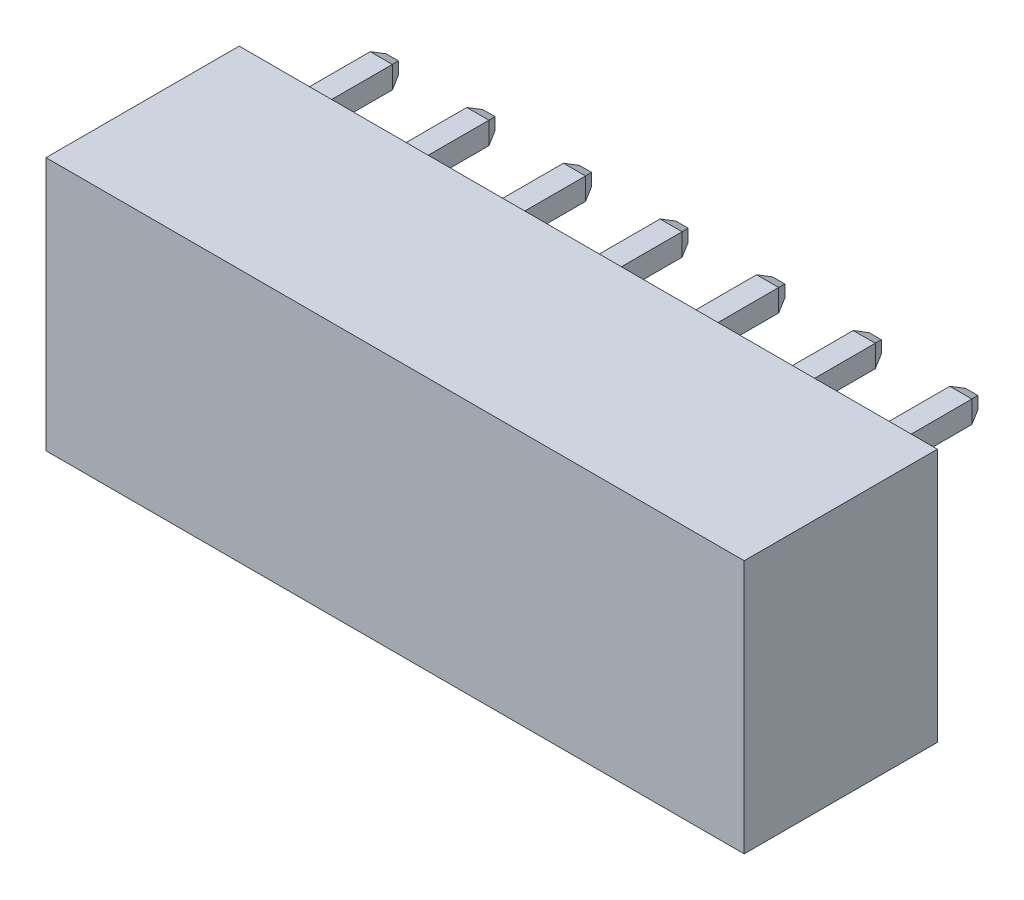
from build123d import *
from OCP.BRepFilletAPI import BRepFilletAPI_MakeChamfer

# Parameters (mm, degrees)
SKETCH_1_W                          = 25.3
SKETCH_1_H                          = 9.2
EXTRUDE_1_DEPTH                     = 7
SKETCH_2_W                          = 0.8
SKETCH_2_H                          = 0.8
EXTRUDE_2_DEPTH                     = 3.4
CHAMFER_1_SIZE                      = 0.4
CHAMFER_1_SIZE2                     = 0.178091474
CUT_EXTRUDE_1_DEPTH                 = 7
PATTERN_LINEAR_1_COUNT              = 7
PATTERN_LINEAR_1_PITCH              = 3.5
CHAMFER_1_OF_PATTERN_LINEAR_1_SIZE  = 0.4
CHAMFER_1_OF_PATTERN_LINEAR_1_SIZE2 = 0.178091474
PATTERN_LINEAR_2_COUNT              = 7
PATTERN_LINEAR_2_PITCH              = 3.5
SKETCH_4_W                          = 0.8
SKETCH_4_H                          = 0.8
EXTRUDE_3_DEPTH                     = 6
CHAMFER_2_SIZE                      = 0.4
CHAMFER_2_SIZE2                     = 0.178091474
PATTERN_LINEAR_3_COUNT              = 7
PATTERN_LINEAR_3_PITCH              = 3.5
CHAMFER_2_OF_PATTERN_LINEAR_3_SIZE  = 0.4
CHAMFER_2_OF_PATTERN_LINEAR_3_SIZE2 = 0.178091474


with BuildPart() as part:
    # Эскиз1 → Бобышка-Вытянуть1 (new body)
    with BuildSketch(Plane.XY):
        with Locations((0, 4.6)):
            Rectangle(SKETCH_1_W, SKETCH_1_H)
    extrude(amount=EXTRUDE_1_DEPTH)

    # Эскиз2 → Бобышка-Вытянуть2 (add)
    with BuildSketch(Plane(origin=(0, 0, 0), x_dir=(-1, 0, 0), z_dir=(0, 0, -1))):
        with Locations((-10.5, 8)):
            Rectangle(SKETCH_2_W, SKETCH_2_H)
    extrude_2 = extrude(amount=EXTRUDE_2_DEPTH)

    # Фаска1: one chamfer whose edges measure the first distance from different faces: ONE call of the kernel's chamfer builder (chamfer() names one face for all edges)
    chamfer_1_edges_1 = [part.edges().sort_by_distance(p)[0] for p in [
        (10.5, 8.4, -3.4),
    ]]
    chamfer_1_side_1 = [part.faces().sort_by_distance(p)[0] for p in [
        (10.5, 8.4, -1.7),
    ]]
    chamfer_1_edges_2 = [part.edges().sort_by_distance(p)[0] for p in [
        (10.1, 8, -3.4),
    ]]
    chamfer_1_side_2 = [part.faces().sort_by_distance(p)[0] for p in [
        (10.1, 8, -1.7),
    ]]
    chamfer_1_edges_3 = [part.edges().sort_by_distance(p)[0] for p in [
        (10.5, 7.6, -3.4),
    ]]
    chamfer_1_side_3 = [part.faces().sort_by_distance(p)[0] for p in [
        (10.5, 7.6, -1.7),
    ]]
    chamfer_1_edges_4 = [part.edges().sort_by_distance(p)[0] for p in [
        (10.9, 8, -3.4),
    ]]
    chamfer_1_side_4 = [part.faces().sort_by_distance(p)[0] for p in [
        (10.9, 8, -1.7),
    ]]
    chamfer_1 = BRepFilletAPI_MakeChamfer(part.part.solid().wrapped)
    for e in chamfer_1_edges_1:
        chamfer_1.Add(CHAMFER_1_SIZE, CHAMFER_1_SIZE2, e.wrapped, chamfer_1_side_1[0].wrapped)  # the first distance lies on this face
    for e in chamfer_1_edges_2:
        chamfer_1.Add(CHAMFER_1_SIZE, CHAMFER_1_SIZE2, e.wrapped, chamfer_1_side_2[0].wrapped)  # the first distance lies on this face
    for e in chamfer_1_edges_3:
        chamfer_1.Add(CHAMFER_1_SIZE, CHAMFER_1_SIZE2, e.wrapped, chamfer_1_side_3[0].wrapped)  # the first distance lies on this face
    for e in chamfer_1_edges_4:
        chamfer_1.Add(CHAMFER_1_SIZE, CHAMFER_1_SIZE2, e.wrapped, chamfer_1_side_4[0].wrapped)  # the first distance lies on this face
    add(Compound.cast(chamfer_1.Shape()), mode=Mode.REPLACE)

    # Эскиз3 → Вырез-Вытянуть1 (cut)
    with BuildSketch(Plane.XZ):
        Polygon((8.9, 0.8), (12, 0.8), (12, 5), (11, 5), (12, 6.5), (8.9, 6.5), (9.9, 5), (8.9, 5), align=None)
    cut_extrude_1 = extrude(amount=-CUT_EXTRUDE_1_DEPTH, mode=Mode.SUBTRACT)

    # Линейный массив1: Бобышка-Вытянуть2 ×7
    with Locations(*[(-i * PATTERN_LINEAR_1_PITCH, 0, 0) for i in range(1, PATTERN_LINEAR_1_COUNT)]):
        add(extrude_2)

    # Фаска1 of Линейный массив1: one chamfer whose edges measure the first distance from different faces: ONE call of the kernel's chamfer builder (chamfer() names one face for all edges)
    chamfer_1_of_pattern_linear_1_edges_1 = [part.edges().sort_by_distance(p)[0] for p in [
        (7, 8.4, -3.4),
    ]]
    chamfer_1_of_pattern_linear_1_side_1 = [part.faces().sort_by_distance(p)[0] for p in [
        (7, 8.4, -1.7),
    ]]
    chamfer_1_of_pattern_linear_1_edges_2 = [part.edges().sort_by_distance(p)[0] for p in [
        (6.6, 8, -3.4),
    ]]
    chamfer_1_of_pattern_linear_1_side_2 = [part.faces().sort_by_distance(p)[0] for p in [
        (6.6, 8, -1.7),
    ]]
    chamfer_1_of_pattern_linear_1_edges_3 = [part.edges().sort_by_distance(p)[0] for p in [
        (7, 7.6, -3.4),
    ]]
    chamfer_1_of_pattern_linear_1_side_3 = [part.faces().sort_by_distance(p)[0] for p in [
        (7, 7.6, -1.7),
    ]]
    chamfer_1_of_pattern_linear_1_edges_4 = [part.edges().sort_by_distance(p)[0] for p in [
        (7.4, 8, -3.4),
    ]]
    chamfer_1_of_pattern_linear_1_side_4 = [part.faces().sort_by_distance(p)[0] for p in [
        (7.4, 8, -1.7),
    ]]
    chamfer_1_of_pattern_linear_1_edges_5 = [part.edges().sort_by_distance(p)[0] for p in [
        (3.5, 8.4, -3.4),
    ]]
    chamfer_1_of_pattern_linear_1_side_5 = [part.faces().sort_by_distance(p)[0] for p in [
        (3.5, 8.4, -1.7),
    ]]
    chamfer_1_of_pattern_linear_1_edges_6 = [part.edges().sort_by_distance(p)[0] for p in [
        (3.1, 8, -3.4),
    ]]
    chamfer_1_of_pattern_linear_1_side_6 = [part.faces().sort_by_distance(p)[0] for p in [
        (3.1, 8, -1.7),
    ]]
    chamfer_1_of_pattern_linear_1_edges_7 = [part.edges().sort_by_distance(p)[0] for p in [
        (3.5, 7.6, -3.4),
    ]]
    chamfer_1_of_pattern_linear_1_side_7 = [part.faces().sort_by_distance(p)[0] for p in [
        (3.5, 7.6, -1.7),
    ]]
    chamfer_1_of_pattern_linear_1_edges_8 = [part.edges().sort_by_distance(p)[0] for p in [
        (3.9, 8, -3.4),
    ]]
    chamfer_1_of_pattern_linear_1_side_8 = [part.faces().sort_by_distance(p)[0] for p in [
        (3.9, 8, -1.7),
    ]]
    chamfer_1_of_pattern_linear_1_edges_9 = [part.edges().sort_by_distance(p)[0] for p in [
        (0, 8.4, -3.4),
    ]]
    chamfer_1_of_pattern_linear_1_side_9 = [part.faces().sort_by_distance(p)[0] for p in [
        (0, 8.4, -1.7),
    ]]
    chamfer_1_of_pattern_linear_1_edges_10 = [part.edges().sort_by_distance(p)[0] for p in [
        (-0.4, 8, -3.4),
    ]]
    chamfer_1_of_pattern_linear_1_side_10 = [part.faces().sort_by_distance(p)[0] for p in [
        (-0.4, 8, -1.7),
    ]]
    chamfer_1_of_pattern_linear_1_edges_11 = [part.edges().sort_by_distance(p)[0] for p in [
        (0, 7.6, -3.4),
    ]]
    chamfer_1_of_pattern_linear_1_side_11 = [part.faces().sort_by_distance(p)[0] for p in [
        (0, 7.6, -1.7),
    ]]
    chamfer_1_of_pattern_linear_1_edges_12 = [part.edges().sort_by_distance(p)[0] for p in [
        (0.4, 8, -3.4),
    ]]
    chamfer_1_of_pattern_linear_1_side_12 = [part.faces().sort_by_distance(p)[0] for p in [
        (0.4, 8, -1.7),
    ]]
    chamfer_1_of_pattern_linear_1_edges_13 = [part.edges().sort_by_distance(p)[0] for p in [
        (-3.5, 8.4, -3.4),
    ]]
    chamfer_1_of_pattern_linear_1_side_13 = [part.faces().sort_by_distance(p)[0] for p in [
        (-3.5, 8.4, -1.7),
    ]]
    chamfer_1_of_pattern_linear_1_edges_14 = [part.edges().sort_by_distance(p)[0] for p in [
        (-3.9, 8, -3.4),
    ]]
    chamfer_1_of_pattern_linear_1_side_14 = [part.faces().sort_by_distance(p)[0] for p in [
        (-3.9, 8, -1.7),
    ]]
    chamfer_1_of_pattern_linear_1_edges_15 = [part.edges().sort_by_distance(p)[0] for p in [
        (-3.5, 7.6, -3.4),
    ]]
    chamfer_1_of_pattern_linear_1_side_15 = [part.faces().sort_by_distance(p)[0] for p in [
        (-3.5, 7.6, -1.7),
    ]]
    chamfer_1_of_pattern_linear_1_edges_16 = [part.edges().sort_by_distance(p)[0] for p in [
        (-3.1, 8, -3.4),
    ]]
    chamfer_1_of_pattern_linear_1_side_16 = [part.faces().sort_by_distance(p)[0] for p in [
        (-3.1, 8, -1.7),
    ]]
    chamfer_1_of_pattern_linear_1_edges_17 = [part.edges().sort_by_distance(p)[0] for p in [
        (-7, 8.4, -3.4),
    ]]
    chamfer_1_of_pattern_linear_1_side_17 = [part.faces().sort_by_distance(p)[0] for p in [
        (-7, 8.4, -1.7),
    ]]
    chamfer_1_of_pattern_linear_1_edges_18 = [part.edges().sort_by_distance(p)[0] for p in [
        (-7.4, 8, -3.4),
    ]]
    chamfer_1_of_pattern_linear_1_side_18 = [part.faces().sort_by_distance(p)[0] for p in [
        (-7.4, 8, -1.7),
    ]]
    chamfer_1_of_pattern_linear_1_edges_19 = [part.edges().sort_by_distance(p)[0] for p in [
        (-7, 7.6, -3.4),
    ]]
    chamfer_1_of_pattern_linear_1_side_19 = [part.faces().sort_by_distance(p)[0] for p in [
        (-7, 7.6, -1.7),
    ]]
    chamfer_1_of_pattern_linear_1_edges_20 = [part.edges().sort_by_distance(p)[0] for p in [
        (-6.6, 8, -3.4),
    ]]
    chamfer_1_of_pattern_linear_1_side_20 = [part.faces().sort_by_distance(p)[0] for p in [
        (-6.6, 8, -1.7),
    ]]
    chamfer_1_of_pattern_linear_1_edges_21 = [part.edges().sort_by_distance(p)[0] for p in [
        (-10.5, 8.4, -3.4),
    ]]
    chamfer_1_of_pattern_linear_1_side_21 = [part.faces().sort_by_distance(p)[0] for p in [
        (-10.5, 8.4, -1.7),
    ]]
    chamfer_1_of_pattern_linear_1_edges_22 = [part.edges().sort_by_distance(p)[0] for p in [
        (-10.9, 8, -3.4),
    ]]
    chamfer_1_of_pattern_linear_1_side_22 = [part.faces().sort_by_distance(p)[0] for p in [
        (-10.9, 8, -1.7),
    ]]
    chamfer_1_of_pattern_linear_1_edges_23 = [part.edges().sort_by_distance(p)[0] for p in [
        (-10.5, 7.6, -3.4),
    ]]
    chamfer_1_of_pattern_linear_1_side_23 = [part.faces().sort_by_distance(p)[0] for p in [
        (-10.5, 7.6, -1.7),
    ]]
    chamfer_1_of_pattern_linear_1_edges_24 = [part.edges().sort_by_distance(p)[0] for p in [
        (-10.1, 8, -3.4),
    ]]
    chamfer_1_of_pattern_linear_1_side_24 = [part.faces().sort_by_distance(p)[0] for p in [
        (-10.1, 8, -1.7),
    ]]
    chamfer_1_of_pattern_linear_1 = BRepFilletAPI_MakeChamfer(part.part.solid().wrapped)
    for e in chamfer_1_of_pattern_linear_1_edges_1:
        chamfer_1_of_pattern_linear_1.Add(CHAMFER_1_OF_PATTERN_LINEAR_1_SIZE, CHAMFER_1_OF_PATTERN_LINEAR_1_SIZE2, e.wrapped, chamfer_1_of_pattern_linear_1_side_1[0].wrapped)  # the first distance lies on this face
    for e in chamfer_1_of_pattern_linear_1_edges_2:
        chamfer_1_of_pattern_linear_1.Add(CHAMFER_1_OF_PATTERN_LINEAR_1_SIZE, CHAMFER_1_OF_PATTERN_LINEAR_1_SIZE2, e.wrapped, chamfer_1_of_pattern_linear_1_side_2[0].wrapped)  # the first distance lies on this face
    for e in chamfer_1_of_pattern_linear_1_edges_3:
        chamfer_1_of_pattern_linear_1.Add(CHAMFER_1_OF_PATTERN_LINEAR_1_SIZE, CHAMFER_1_OF_PATTERN_LINEAR_1_SIZE2, e.wrapped, chamfer_1_of_pattern_linear_1_side_3[0].wrapped)  # the first distance lies on this face
    for e in chamfer_1_of_pattern_linear_1_edges_4:
        chamfer_1_of_pattern_linear_1.Add(CHAMFER_1_OF_PATTERN_LINEAR_1_SIZE, CHAMFER_1_OF_PATTERN_LINEAR_1_SIZE2, e.wrapped, chamfer_1_of_pattern_linear_1_side_4[0].wrapped)  # the first distance lies on this face
    for e in chamfer_1_of_pattern_linear_1_edges_5:
        chamfer_1_of_pattern_linear_1.Add(CHAMFER_1_OF_PATTERN_LINEAR_1_SIZE, CHAMFER_1_OF_PATTERN_LINEAR_1_SIZE2, e.wrapped, chamfer_1_of_pattern_linear_1_side_5[0].wrapped)  # the first distance lies on this face
    for e in chamfer_1_of_pattern_linear_1_edges_6:
        chamfer_1_of_pattern_linear_1.Add(CHAMFER_1_OF_PATTERN_LINEAR_1_SIZE, CHAMFER_1_OF_PATTERN_LINEAR_1_SIZE2, e.wrapped, chamfer_1_of_pattern_linear_1_side_6[0].wrapped)  # the first distance lies on this face
    for e in chamfer_1_of_pattern_linear_1_edges_7:
        chamfer_1_of_pattern_linear_1.Add(CHAMFER_1_OF_PATTERN_LINEAR_1_SIZE, CHAMFER_1_OF_PATTERN_LINEAR_1_SIZE2, e.wrapped, chamfer_1_of_pattern_linear_1_side_7[0].wrapped)  # the first distance lies on this face
    for e in chamfer_1_of_pattern_linear_1_edges_8:
        chamfer_1_of_pattern_linear_1.Add(CHAMFER_1_OF_PATTERN_LINEAR_1_SIZE, CHAMFER_1_OF_PATTERN_LINEAR_1_SIZE2, e.wrapped, chamfer_1_of_pattern_linear_1_side_8[0].wrapped)  # the first distance lies on this face
    for e in chamfer_1_of_pattern_linear_1_edges_9:
        chamfer_1_of_pattern_linear_1.Add(CHAMFER_1_OF_PATTERN_LINEAR_1_SIZE, CHAMFER_1_OF_PATTERN_LINEAR_1_SIZE2, e.wrapped, chamfer_1_of_pattern_linear_1_side_9[0].wrapped)  # the first distance lies on this face
    for e in chamfer_1_of_pattern_linear_1_edges_10:
        chamfer_1_of_pattern_linear_1.Add(CHAMFER_1_OF_PATTERN_LINEAR_1_SIZE, CHAMFER_1_OF_PATTERN_LINEAR_1_SIZE2, e.wrapped, chamfer_1_of_pattern_linear_1_side_10[0].wrapped)  # the first distance lies on this face
    for e in chamfer_1_of_pattern_linear_1_edges_11:
        chamfer_1_of_pattern_linear_1.Add(CHAMFER_1_OF_PATTERN_LINEAR_1_SIZE, CHAMFER_1_OF_PATTERN_LINEAR_1_SIZE2, e.wrapped, chamfer_1_of_pattern_linear_1_side_11[0].wrapped)  # the first distance lies on this face
    for e in chamfer_1_of_pattern_linear_1_edges_12:
        chamfer_1_of_pattern_linear_1.Add(CHAMFER_1_OF_PATTERN_LINEAR_1_SIZE, CHAMFER_1_OF_PATTERN_LINEAR_1_SIZE2, e.wrapped, chamfer_1_of_pattern_linear_1_side_12[0].wrapped)  # the first distance lies on this face
    for e in chamfer_1_of_pattern_linear_1_edges_13:
        chamfer_1_of_pattern_linear_1.Add(CHAMFER_1_OF_PATTERN_LINEAR_1_SIZE, CHAMFER_1_OF_PATTERN_LINEAR_1_SIZE2, e.wrapped, chamfer_1_of_pattern_linear_1_side_13[0].wrapped)  # the first distance lies on this face
    for e in chamfer_1_of_pattern_linear_1_edges_14:
        chamfer_1_of_pattern_linear_1.Add(CHAMFER_1_OF_PATTERN_LINEAR_1_SIZE, CHAMFER_1_OF_PATTERN_LINEAR_1_SIZE2, e.wrapped, chamfer_1_of_pattern_linear_1_side_14[0].wrapped)  # the first distance lies on this face
    for e in chamfer_1_of_pattern_linear_1_edges_15:
        chamfer_1_of_pattern_linear_1.Add(CHAMFER_1_OF_PATTERN_LINEAR_1_SIZE, CHAMFER_1_OF_PATTERN_LINEAR_1_SIZE2, e.wrapped, chamfer_1_of_pattern_linear_1_side_15[0].wrapped)  # the first distance lies on this face
    for e in chamfer_1_of_pattern_linear_1_edges_16:
        chamfer_1_of_pattern_linear_1.Add(CHAMFER_1_OF_PATTERN_LINEAR_1_SIZE, CHAMFER_1_OF_PATTERN_LINEAR_1_SIZE2, e.wrapped, chamfer_1_of_pattern_linear_1_side_16[0].wrapped)  # the first distance lies on this face
    for e in chamfer_1_of_pattern_linear_1_edges_17:
        chamfer_1_of_pattern_linear_1.Add(CHAMFER_1_OF_PATTERN_LINEAR_1_SIZE, CHAMFER_1_OF_PATTERN_LINEAR_1_SIZE2, e.wrapped, chamfer_1_of_pattern_linear_1_side_17[0].wrapped)  # the first distance lies on this face
    for e in chamfer_1_of_pattern_linear_1_edges_18:
        chamfer_1_of_pattern_linear_1.Add(CHAMFER_1_OF_PATTERN_LINEAR_1_SIZE, CHAMFER_1_OF_PATTERN_LINEAR_1_SIZE2, e.wrapped, chamfer_1_of_pattern_linear_1_side_18[0].wrapped)  # the first distance lies on this face
    for e in chamfer_1_of_pattern_linear_1_edges_19:
        chamfer_1_of_pattern_linear_1.Add(CHAMFER_1_OF_PATTERN_LINEAR_1_SIZE, CHAMFER_1_OF_PATTERN_LINEAR_1_SIZE2, e.wrapped, chamfer_1_of_pattern_linear_1_side_19[0].wrapped)  # the first distance lies on this face
    for e in chamfer_1_of_pattern_linear_1_edges_20:
        chamfer_1_of_pattern_linear_1.Add(CHAMFER_1_OF_PATTERN_LINEAR_1_SIZE, CHAMFER_1_OF_PATTERN_LINEAR_1_SIZE2, e.wrapped, chamfer_1_of_pattern_linear_1_side_20[0].wrapped)  # the first distance lies on this face
    for e in chamfer_1_of_pattern_linear_1_edges_21:
        chamfer_1_of_pattern_linear_1.Add(CHAMFER_1_OF_PATTERN_LINEAR_1_SIZE, CHAMFER_1_OF_PATTERN_LINEAR_1_SIZE2, e.wrapped, chamfer_1_of_pattern_linear_1_side_21[0].wrapped)  # the first distance lies on this face
    for e in chamfer_1_of_pattern_linear_1_edges_22:
        chamfer_1_of_pattern_linear_1.Add(CHAMFER_1_OF_PATTERN_LINEAR_1_SIZE, CHAMFER_1_OF_PATTERN_LINEAR_1_SIZE2, e.wrapped, chamfer_1_of_pattern_linear_1_side_22[0].wrapped)  # the first distance lies on this face
    for e in chamfer_1_of_pattern_linear_1_edges_23:
        chamfer_1_of_pattern_linear_1.Add(CHAMFER_1_OF_PATTERN_LINEAR_1_SIZE, CHAMFER_1_OF_PATTERN_LINEAR_1_SIZE2, e.wrapped, chamfer_1_of_pattern_linear_1_side_23[0].wrapped)  # the first distance lies on this face
    for e in chamfer_1_of_pattern_linear_1_edges_24:
        chamfer_1_of_pattern_linear_1.Add(CHAMFER_1_OF_PATTERN_LINEAR_1_SIZE, CHAMFER_1_OF_PATTERN_LINEAR_1_SIZE2, e.wrapped, chamfer_1_of_pattern_linear_1_side_24[0].wrapped)  # the first distance lies on this face
    add(Compound.cast(chamfer_1_of_pattern_linear_1.Shape()), mode=Mode.REPLACE)

    # Линейный массив2: Вырез-Вытянуть1 ×7
    with Locations(*[(-i * PATTERN_LINEAR_2_PITCH, 0, 0) for i in range(1, PATTERN_LINEAR_2_COUNT)]):
        add(cut_extrude_1, mode=Mode.SUBTRACT)

    # Эскиз4 → Бобышка-Вытянуть3 (add)
    with BuildSketch(Plane.XZ.offset(-7)):
        with Locations((10.5, 3)):
            Rectangle(SKETCH_4_W, SKETCH_4_H)
    extrude_3 = extrude(amount=EXTRUDE_3_DEPTH)

    # Фаска2: one chamfer whose edges measure the first distance from different faces: ONE call of the kernel's chamfer builder (chamfer() names one face for all edges)
    chamfer_2_edges_1 = [part.edges().sort_by_distance(p)[0] for p in [
        (10.9, 1, 3),
    ]]
    chamfer_2_side_1 = [part.faces().sort_by_distance(p)[0] for p in [
        (10.9, 4, 3),
    ]]
    chamfer_2_edges_2 = [part.edges().sort_by_distance(p)[0] for p in [
        (10.5, 1, 3.4),
    ]]
    chamfer_2_side_2 = [part.faces().sort_by_distance(p)[0] for p in [
        (10.5, 4, 3.4),
    ]]
    chamfer_2_edges_3 = [part.edges().sort_by_distance(p)[0] for p in [
        (10.1, 1, 3),
    ]]
    chamfer_2_side_3 = [part.faces().sort_by_distance(p)[0] for p in [
        (10.1, 4, 3),
    ]]
    chamfer_2_edges_4 = [part.edges().sort_by_distance(p)[0] for p in [
        (10.5, 1, 2.6),
    ]]
    chamfer_2_side_4 = [part.faces().sort_by_distance(p)[0] for p in [
        (10.5, 4, 2.6),
    ]]
    chamfer_2 = BRepFilletAPI_MakeChamfer(part.part.solid().wrapped)
    for e in chamfer_2_edges_1:
        chamfer_2.Add(CHAMFER_2_SIZE, CHAMFER_2_SIZE2, e.wrapped, chamfer_2_side_1[0].wrapped)  # the first distance lies on this face
    for e in chamfer_2_edges_2:
        chamfer_2.Add(CHAMFER_2_SIZE, CHAMFER_2_SIZE2, e.wrapped, chamfer_2_side_2[0].wrapped)  # the first distance lies on this face
    for e in chamfer_2_edges_3:
        chamfer_2.Add(CHAMFER_2_SIZE, CHAMFER_2_SIZE2, e.wrapped, chamfer_2_side_3[0].wrapped)  # the first distance lies on this face
    for e in chamfer_2_edges_4:
        chamfer_2.Add(CHAMFER_2_SIZE, CHAMFER_2_SIZE2, e.wrapped, chamfer_2_side_4[0].wrapped)  # the first distance lies on this face
    add(Compound.cast(chamfer_2.Shape()), mode=Mode.REPLACE)

    # Линейный массив3: Бобышка-Вытянуть3 ×7
    with Locations(*[(-i * PATTERN_LINEAR_3_PITCH, 0, 0) for i in range(1, PATTERN_LINEAR_3_COUNT)]):
        add(extrude_3)

    # Фаска2 of Линейный массив3: one chamfer whose edges measure the first distance from different faces: ONE call of the kernel's chamfer builder (chamfer() names one face for all edges)
    chamfer_2_of_pattern_linear_3_edges_1 = [part.edges().sort_by_distance(p)[0] for p in [
        (7.4, 1, 3),
    ]]
    chamfer_2_of_pattern_linear_3_side_1 = [part.faces().sort_by_distance(p)[0] for p in [
        (7.4, 4, 3),
    ]]
    chamfer_2_of_pattern_linear_3_edges_2 = [part.edges().sort_by_distance(p)[0] for p in [
        (7, 1, 3.4),
    ]]
    chamfer_2_of_pattern_linear_3_side_2 = [part.faces().sort_by_distance(p)[0] for p in [
        (7, 4, 3.4),
    ]]
    chamfer_2_of_pattern_linear_3_edges_3 = [part.edges().sort_by_distance(p)[0] for p in [
        (6.6, 1, 3),
    ]]
    chamfer_2_of_pattern_linear_3_side_3 = [part.faces().sort_by_distance(p)[0] for p in [
        (6.6, 4, 3),
    ]]
    chamfer_2_of_pattern_linear_3_edges_4 = [part.edges().sort_by_distance(p)[0] for p in [
        (7, 1, 2.6),
    ]]
    chamfer_2_of_pattern_linear_3_side_4 = [part.faces().sort_by_distance(p)[0] for p in [
        (7, 4, 2.6),
    ]]
    chamfer_2_of_pattern_linear_3_edges_5 = [part.edges().sort_by_distance(p)[0] for p in [
        (3.9, 1, 3),
    ]]
    chamfer_2_of_pattern_linear_3_side_5 = [part.faces().sort_by_distance(p)[0] for p in [
        (3.9, 4, 3),
    ]]
    chamfer_2_of_pattern_linear_3_edges_6 = [part.edges().sort_by_distance(p)[0] for p in [
        (3.5, 1, 3.4),
    ]]
    chamfer_2_of_pattern_linear_3_side_6 = [part.faces().sort_by_distance(p)[0] for p in [
        (3.5, 4, 3.4),
    ]]
    chamfer_2_of_pattern_linear_3_edges_7 = [part.edges().sort_by_distance(p)[0] for p in [
        (3.1, 1, 3),
    ]]
    chamfer_2_of_pattern_linear_3_side_7 = [part.faces().sort_by_distance(p)[0] for p in [
        (3.1, 4, 3),
    ]]
    chamfer_2_of_pattern_linear_3_edges_8 = [part.edges().sort_by_distance(p)[0] for p in [
        (3.5, 1, 2.6),
    ]]
    chamfer_2_of_pattern_linear_3_side_8 = [part.faces().sort_by_distance(p)[0] for p in [
        (3.5, 4, 2.6),
    ]]
    chamfer_2_of_pattern_linear_3_edges_9 = [part.edges().sort_by_distance(p)[0] for p in [
        (0.4, 1, 3),
    ]]
    chamfer_2_of_pattern_linear_3_side_9 = [part.faces().sort_by_distance(p)[0] for p in [
        (0.4, 4, 3),
    ]]
    chamfer_2_of_pattern_linear_3_edges_10 = [part.edges().sort_by_distance(p)[0] for p in [
        (0, 1, 3.4),
    ]]
    chamfer_2_of_pattern_linear_3_side_10 = [part.faces().sort_by_distance(p)[0] for p in [
        (0, 4, 3.4),
    ]]
    chamfer_2_of_pattern_linear_3_edges_11 = [part.edges().sort_by_distance(p)[0] for p in [
        (-0.4, 1, 3),
    ]]
    chamfer_2_of_pattern_linear_3_side_11 = [part.faces().sort_by_distance(p)[0] for p in [
        (-0.4, 4, 3),
    ]]
    chamfer_2_of_pattern_linear_3_edges_12 = [part.edges().sort_by_distance(p)[0] for p in [
        (0, 1, 2.6),
    ]]
    chamfer_2_of_pattern_linear_3_side_12 = [part.faces().sort_by_distance(p)[0] for p in [
        (0, 4, 2.6),
    ]]
    chamfer_2_of_pattern_linear_3_edges_13 = [part.edges().sort_by_distance(p)[0] for p in [
        (-3.1, 1, 3),
    ]]
    chamfer_2_of_pattern_linear_3_side_13 = [part.faces().sort_by_distance(p)[0] for p in [
        (-3.1, 4, 3),
    ]]
    chamfer_2_of_pattern_linear_3_edges_14 = [part.edges().sort_by_distance(p)[0] for p in [
        (-3.5, 1, 3.4),
    ]]
    chamfer_2_of_pattern_linear_3_side_14 = [part.faces().sort_by_distance(p)[0] for p in [
        (-3.5, 4, 3.4),
    ]]
    chamfer_2_of_pattern_linear_3_edges_15 = [part.edges().sort_by_distance(p)[0] for p in [
        (-3.9, 1, 3),
    ]]
    chamfer_2_of_pattern_linear_3_side_15 = [part.faces().sort_by_distance(p)[0] for p in [
        (-3.9, 4, 3),
    ]]
    chamfer_2_of_pattern_linear_3_edges_16 = [part.edges().sort_by_distance(p)[0] for p in [
        (-3.5, 1, 2.6),
    ]]
    chamfer_2_of_pattern_linear_3_side_16 = [part.faces().sort_by_distance(p)[0] for p in [
        (-3.5, 4, 2.6),
    ]]
    chamfer_2_of_pattern_linear_3_edges_17 = [part.edges().sort_by_distance(p)[0] for p in [
        (-6.6, 1, 3),
    ]]
    chamfer_2_of_pattern_linear_3_side_17 = [part.faces().sort_by_distance(p)[0] for p in [
        (-6.6, 4, 3),
    ]]
    chamfer_2_of_pattern_linear_3_edges_18 = [part.edges().sort_by_distance(p)[0] for p in [
        (-7, 1, 3.4),
    ]]
    chamfer_2_of_pattern_linear_3_side_18 = [part.faces().sort_by_distance(p)[0] for p in [
        (-7, 4, 3.4),
    ]]
    chamfer_2_of_pattern_linear_3_edges_19 = [part.edges().sort_by_distance(p)[0] for p in [
        (-7.4, 1, 3),
    ]]
    chamfer_2_of_pattern_linear_3_side_19 = [part.faces().sort_by_distance(p)[0] for p in [
        (-7.4, 4, 3),
    ]]
    chamfer_2_of_pattern_linear_3_edges_20 = [part.edges().sort_by_distance(p)[0] for p in [
        (-7, 1, 2.6),
    ]]
    chamfer_2_of_pattern_linear_3_side_20 = [part.faces().sort_by_distance(p)[0] for p in [
        (-7, 4, 2.6),
    ]]
    chamfer_2_of_pattern_linear_3_edges_21 = [part.edges().sort_by_distance(p)[0] for p in [
        (-10.1, 1, 3),
    ]]
    chamfer_2_of_pattern_linear_3_side_21 = [part.faces().sort_by_distance(p)[0] for p in [
        (-10.1, 4, 3),
    ]]
    chamfer_2_of_pattern_linear_3_edges_22 = [part.edges().sort_by_distance(p)[0] for p in [
        (-10.5, 1, 3.4),
    ]]
    chamfer_2_of_pattern_linear_3_side_22 = [part.faces().sort_by_distance(p)[0] for p in [
        (-10.5, 4, 3.4),
    ]]
    chamfer_2_of_pattern_linear_3_edges_23 = [part.edges().sort_by_distance(p)[0] for p in [
        (-10.9, 1, 3),
    ]]
    chamfer_2_of_pattern_linear_3_side_23 = [part.faces().sort_by_distance(p)[0] for p in [
        (-10.9, 4, 3),
    ]]
    chamfer_2_of_pattern_linear_3_edges_24 = [part.edges().sort_by_distance(p)[0] for p in [
        (-10.5, 1, 2.6),
    ]]
    chamfer_2_of_pattern_linear_3_side_24 = [part.faces().sort_by_distance(p)[0] for p in [
        (-10.5, 4, 2.6),
    ]]
    chamfer_2_of_pattern_linear_3 = BRepFilletAPI_MakeChamfer(part.part.solid().wrapped)
    for e in chamfer_2_of_pattern_linear_3_edges_1:
        chamfer_2_of_pattern_linear_3.Add(CHAMFER_2_OF_PATTERN_LINEAR_3_SIZE, CHAMFER_2_OF_PATTERN_LINEAR_3_SIZE2, e.wrapped, chamfer_2_of_pattern_linear_3_side_1[0].wrapped)  # the first distance lies on this face
    for e in chamfer_2_of_pattern_linear_3_edges_2:
        chamfer_2_of_pattern_linear_3.Add(CHAMFER_2_OF_PATTERN_LINEAR_3_SIZE, CHAMFER_2_OF_PATTERN_LINEAR_3_SIZE2, e.wrapped, chamfer_2_of_pattern_linear_3_side_2[0].wrapped)  # the first distance lies on this face
    for e in chamfer_2_of_pattern_linear_3_edges_3:
        chamfer_2_of_pattern_linear_3.Add(CHAMFER_2_OF_PATTERN_LINEAR_3_SIZE, CHAMFER_2_OF_PATTERN_LINEAR_3_SIZE2, e.wrapped, chamfer_2_of_pattern_linear_3_side_3[0].wrapped)  # the first distance lies on this face
    for e in chamfer_2_of_pattern_linear_3_edges_4:
        chamfer_2_of_pattern_linear_3.Add(CHAMFER_2_OF_PATTERN_LINEAR_3_SIZE, CHAMFER_2_OF_PATTERN_LINEAR_3_SIZE2, e.wrapped, chamfer_2_of_pattern_linear_3_side_4[0].wrapped)  # the first distance lies on this face
    for e in chamfer_2_of_pattern_linear_3_edges_5:
        chamfer_2_of_pattern_linear_3.Add(CHAMFER_2_OF_PATTERN_LINEAR_3_SIZE, CHAMFER_2_OF_PATTERN_LINEAR_3_SIZE2, e.wrapped, chamfer_2_of_pattern_linear_3_side_5[0].wrapped)  # the first distance lies on this face
    for e in chamfer_2_of_pattern_linear_3_edges_6:
        chamfer_2_of_pattern_linear_3.Add(CHAMFER_2_OF_PATTERN_LINEAR_3_SIZE, CHAMFER_2_OF_PATTERN_LINEAR_3_SIZE2, e.wrapped, chamfer_2_of_pattern_linear_3_side_6[0].wrapped)  # the first distance lies on this face
    for e in chamfer_2_of_pattern_linear_3_edges_7:
        chamfer_2_of_pattern_linear_3.Add(CHAMFER_2_OF_PATTERN_LINEAR_3_SIZE, CHAMFER_2_OF_PATTERN_LINEAR_3_SIZE2, e.wrapped, chamfer_2_of_pattern_linear_3_side_7[0].wrapped)  # the first distance lies on this face
    for e in chamfer_2_of_pattern_linear_3_edges_8:
        chamfer_2_of_pattern_linear_3.Add(CHAMFER_2_OF_PATTERN_LINEAR_3_SIZE, CHAMFER_2_OF_PATTERN_LINEAR_3_SIZE2, e.wrapped, chamfer_2_of_pattern_linear_3_side_8[0].wrapped)  # the first distance lies on this face
    for e in chamfer_2_of_pattern_linear_3_edges_9:
        chamfer_2_of_pattern_linear_3.Add(CHAMFER_2_OF_PATTERN_LINEAR_3_SIZE, CHAMFER_2_OF_PATTERN_LINEAR_3_SIZE2, e.wrapped, chamfer_2_of_pattern_linear_3_side_9[0].wrapped)  # the first distance lies on this face
    for e in chamfer_2_of_pattern_linear_3_edges_10:
        chamfer_2_of_pattern_linear_3.Add(CHAMFER_2_OF_PATTERN_LINEAR_3_SIZE, CHAMFER_2_OF_PATTERN_LINEAR_3_SIZE2, e.wrapped, chamfer_2_of_pattern_linear_3_side_10[0].wrapped)  # the first distance lies on this face
    for e in chamfer_2_of_pattern_linear_3_edges_11:
        chamfer_2_of_pattern_linear_3.Add(CHAMFER_2_OF_PATTERN_LINEAR_3_SIZE, CHAMFER_2_OF_PATTERN_LINEAR_3_SIZE2, e.wrapped, chamfer_2_of_pattern_linear_3_side_11[0].wrapped)  # the first distance lies on this face
    for e in chamfer_2_of_pattern_linear_3_edges_12:
        chamfer_2_of_pattern_linear_3.Add(CHAMFER_2_OF_PATTERN_LINEAR_3_SIZE, CHAMFER_2_OF_PATTERN_LINEAR_3_SIZE2, e.wrapped, chamfer_2_of_pattern_linear_3_side_12[0].wrapped)  # the first distance lies on this face
    for e in chamfer_2_of_pattern_linear_3_edges_13:
        chamfer_2_of_pattern_linear_3.Add(CHAMFER_2_OF_PATTERN_LINEAR_3_SIZE, CHAMFER_2_OF_PATTERN_LINEAR_3_SIZE2, e.wrapped, chamfer_2_of_pattern_linear_3_side_13[0].wrapped)  # the first distance lies on this face
    for e in chamfer_2_of_pattern_linear_3_edges_14:
        chamfer_2_of_pattern_linear_3.Add(CHAMFER_2_OF_PATTERN_LINEAR_3_SIZE, CHAMFER_2_OF_PATTERN_LINEAR_3_SIZE2, e.wrapped, chamfer_2_of_pattern_linear_3_side_14[0].wrapped)  # the first distance lies on this face
    for e in chamfer_2_of_pattern_linear_3_edges_15:
        chamfer_2_of_pattern_linear_3.Add(CHAMFER_2_OF_PATTERN_LINEAR_3_SIZE, CHAMFER_2_OF_PATTERN_LINEAR_3_SIZE2, e.wrapped, chamfer_2_of_pattern_linear_3_side_15[0].wrapped)  # the first distance lies on this face
    for e in chamfer_2_of_pattern_linear_3_edges_16:
        chamfer_2_of_pattern_linear_3.Add(CHAMFER_2_OF_PATTERN_LINEAR_3_SIZE, CHAMFER_2_OF_PATTERN_LINEAR_3_SIZE2, e.wrapped, chamfer_2_of_pattern_linear_3_side_16[0].wrapped)  # the first distance lies on this face
    for e in chamfer_2_of_pattern_linear_3_edges_17:
        chamfer_2_of_pattern_linear_3.Add(CHAMFER_2_OF_PATTERN_LINEAR_3_SIZE, CHAMFER_2_OF_PATTERN_LINEAR_3_SIZE2, e.wrapped, chamfer_2_of_pattern_linear_3_side_17[0].wrapped)  # the first distance lies on this face
    for e in chamfer_2_of_pattern_linear_3_edges_18:
        chamfer_2_of_pattern_linear_3.Add(CHAMFER_2_OF_PATTERN_LINEAR_3_SIZE, CHAMFER_2_OF_PATTERN_LINEAR_3_SIZE2, e.wrapped, chamfer_2_of_pattern_linear_3_side_18[0].wrapped)  # the first distance lies on this face
    for e in chamfer_2_of_pattern_linear_3_edges_19:
        chamfer_2_of_pattern_linear_3.Add(CHAMFER_2_OF_PATTERN_LINEAR_3_SIZE, CHAMFER_2_OF_PATTERN_LINEAR_3_SIZE2, e.wrapped, chamfer_2_of_pattern_linear_3_side_19[0].wrapped)  # the first distance lies on this face
    for e in chamfer_2_of_pattern_linear_3_edges_20:
        chamfer_2_of_pattern_linear_3.Add(CHAMFER_2_OF_PATTERN_LINEAR_3_SIZE, CHAMFER_2_OF_PATTERN_LINEAR_3_SIZE2, e.wrapped, chamfer_2_of_pattern_linear_3_side_20[0].wrapped)  # the first distance lies on this face
    for e in chamfer_2_of_pattern_linear_3_edges_21:
        chamfer_2_of_pattern_linear_3.Add(CHAMFER_2_OF_PATTERN_LINEAR_3_SIZE, CHAMFER_2_OF_PATTERN_LINEAR_3_SIZE2, e.wrapped, chamfer_2_of_pattern_linear_3_side_21[0].wrapped)  # the first distance lies on this face
    for e in chamfer_2_of_pattern_linear_3_edges_22:
        chamfer_2_of_pattern_linear_3.Add(CHAMFER_2_OF_PATTERN_LINEAR_3_SIZE, CHAMFER_2_OF_PATTERN_LINEAR_3_SIZE2, e.wrapped, chamfer_2_of_pattern_linear_3_side_22[0].wrapped)  # the first distance lies on this face
    for e in chamfer_2_of_pattern_linear_3_edges_23:
        chamfer_2_of_pattern_linear_3.Add(CHAMFER_2_OF_PATTERN_LINEAR_3_SIZE, CHAMFER_2_OF_PATTERN_LINEAR_3_SIZE2, e.wrapped, chamfer_2_of_pattern_linear_3_side_23[0].wrapped)  # the first distance lies on this face
    for e in chamfer_2_of_pattern_linear_3_edges_24:
        chamfer_2_of_pattern_linear_3.Add(CHAMFER_2_OF_PATTERN_LINEAR_3_SIZE, CHAMFER_2_OF_PATTERN_LINEAR_3_SIZE2, e.wrapped, chamfer_2_of_pattern_linear_3_side_24[0].wrapped)  # the first distance lies on this face
    add(Compound.cast(chamfer_2_of_pattern_linear_3.Shape()), mode=Mode.REPLACE)


solid = part.part
